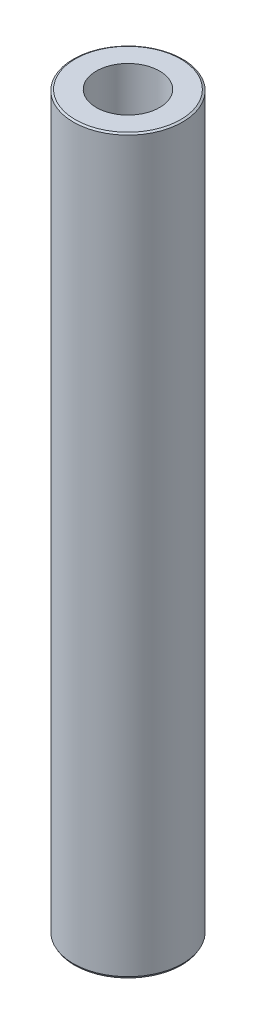
from build123d import *
from OCP.BRepFilletAPI import BRepFilletAPI_MakeChamfer

# Parameters (mm, degrees)
SKETCH1_R           = 40
BOSS_EXTRUDE1_DEPTH = 536.200548136
SKETCH2_R           = 23.19245395
CUT_EXTRUDE1_DEPTH  = 540.176249311
CHAMFER1_SIZE       = 0.826438221
CHAMFER1_SIZE2      = 1.431432989


with BuildPart() as part:
    # Sketch1 → Boss-Extrude1 (new body)
    with BuildSketch(Plane(origin=(0, 0, 0), x_dir=(1, 0, 0), z_dir=(0, 1, 0))):
        Circle(SKETCH1_R)
    extrude(amount=BOSS_EXTRUDE1_DEPTH)

    # Sketch2 → Cut-Extrude1 (cut, through all)
    with BuildSketch(Plane(origin=(0, 0, 0), x_dir=(1, 0, 0), z_dir=(0, 1, 0))):
        Circle(SKETCH2_R)
    extrude(amount=CUT_EXTRUDE1_DEPTH, mode=Mode.SUBTRACT)

    # Chamfer1: one chamfer whose edges measure the first distance from different faces: ONE call of the kernel's chamfer builder (chamfer() names one face for all edges)
    chamfer1_edges_1 = [part.edges().sort_by_distance(p)[0] for p in [
        (-40, 536.200548136, 0),
    ]]
    chamfer1_side_1 = [part.faces().sort_by_distance(p)[0] for p in [
        (-40, 268.100274068, 0),
    ]]
    chamfer1_edges_2 = [part.edges().sort_by_distance(p)[0] for p in [
        (-40, 0, 0),
    ]]
    chamfer1_side_2 = [part.faces().sort_by_distance(p)[0] for p in [
        (-38.86862915, 0, 0),
    ]]
    chamfer1 = BRepFilletAPI_MakeChamfer(part.part.solid().wrapped)
    for e in chamfer1_edges_1:
        chamfer1.Add(CHAMFER1_SIZE, CHAMFER1_SIZE2, e.wrapped, chamfer1_side_1[0].wrapped)  # the first distance lies on this face
    for e in chamfer1_edges_2:
        chamfer1.Add(CHAMFER1_SIZE, CHAMFER1_SIZE2, e.wrapped, chamfer1_side_2[0].wrapped)  # the first distance lies on this face
    add(Compound.cast(chamfer1.Shape()), mode=Mode.REPLACE)


solid = part.part
